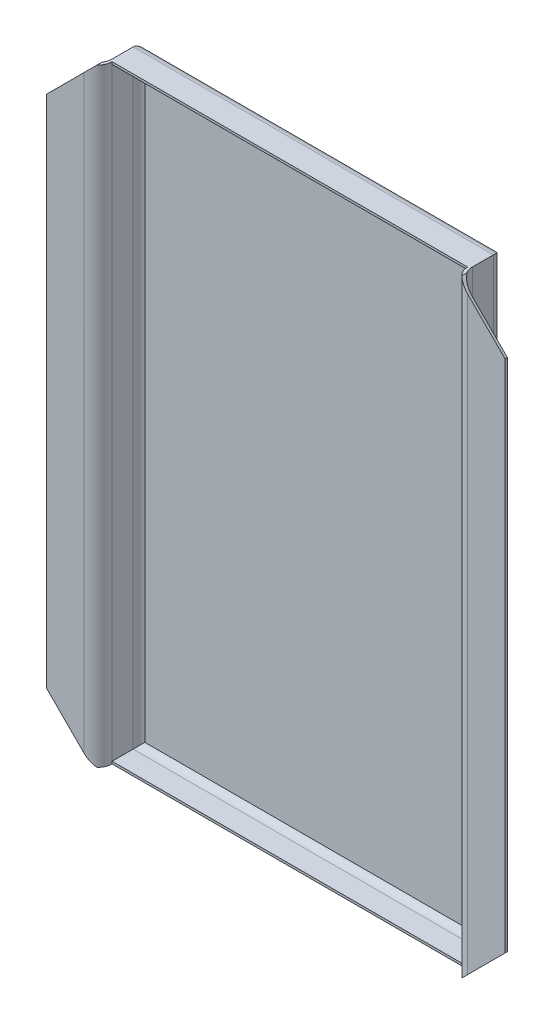
from build123d import *
from build123d.topology import SkipClean

# Parameters (mm, degrees)
SKETCH1_W                = 77
SKETCH1_H                = 130
BOSS_EXTRUDE1_DEPTH      = 10
SKETCH2_W                = 0.5
SKETCH2_H                = 130
BOSS_EXTRUDE2_DEPTH      = 10.5
CHAMFER1_SIZE            = 10
CHAMFER1_OF_MIRROR1_SIZE = 10
SHELL1_START             = -38
SHELL1_OUTLINE_W         = 129
SHELL1_OUTLINE_H         = 9.5
SHELL1_DEPTH             = 76
FILLET1_R                = 2
FILLET2_R                = 3
CUT_EXTRUDE1_DEPTH       = 135.25
SKETCH4_W                = 73
SKETCH4_H                = 126
BOSS_EXTRUDE3_DEPTH      = 1


# Read off the part's stored shape, not the designer's step: Shell1
with BuildPart() as part:
    # Sketch1 → Boss-Extrude1 (new body)
    with BuildSketch(Plane.XY):
        Rectangle(SKETCH1_W, SKETCH1_H)
    extrude(amount=BOSS_EXTRUDE1_DEPTH)

    # Sketch2 → Boss-Extrude2 (add)
    with BuildSketch(Plane(origin=(38.5, 0, 0), x_dir=(0, 0, -1), z_dir=(1, 0, 0))):
        with Locations((-9.75, 0)):
            Rectangle(SKETCH2_W, SKETCH2_H)
    boss_extrude2 = extrude(amount=BOSS_EXTRUDE2_DEPTH)

    # Chamfer1
    chamfer1_edges = [part.edges().sort_by_distance(p)[0] for p in [
        (49, -65, 9.75),
        (49, 65, 9.75),
    ]]
    chamfer(chamfer1_edges, length=CHAMFER1_SIZE)

    # Mirror1: Boss-Extrude2 across plane
    add(boss_extrude2.mirror(Plane(origin=(0, 0, 0), x_dir=(0, 0, 1), z_dir=(1, 0, 0))))

    # Chamfer1 of Mirror1
    chamfer1_of_mirror1_edges = [part.edges().sort_by_distance(p)[0] for p in [
        (-49, -65, 9.75),
        (-49, 65, 9.75),
    ]]
    chamfer(chamfer1_of_mirror1_edges, length=CHAMFER1_OF_MIRROR1_SIZE)

    # Shell1 outline → Shell1 (cut)
    with BuildSketch(Plane.YZ.offset(SHELL1_START)):
        with Locations((0, 5.25)):
            Rectangle(SHELL1_OUTLINE_W, SHELL1_OUTLINE_H)
    extrude(amount=SHELL1_DEPTH, mode=Mode.SUBTRACT)

    # Fillet1
    fillet1_edges = [part.edges().sort_by_distance(p)[0] for p in [
        (0, -65, 0),
        (-38.5, 0, 0),
        (0, 65, 0),
        (38.5, 0, 0),
        (38, 0, 0.5),
        (0, 64.5, 0.5),
        (-38, 0, 0.5),
        (0, -64.5, 0.5),
    ]]
    fillet(fillet1_edges, radius=FILLET1_R)

    # Fillet2
    # the kernel refuses this fillet: 3 mm, written as the material it adds along each edge
    with BuildSketch(Plane(origin=(-38.5, 65, 9.5), x_dir=(0, 0, -1), z_dir=(0, -1, 0))) as fillet2_piece_1_section:
        with BuildLine():
            CenterArc((FILLET2_R, -FILLET2_R), FILLET2_R, 90, 90)
            Line((0, -FILLET2_R), (0, 0))
            Line((0, 0), (FILLET2_R, 0))
        make_face()
    fillet2_piece_1 = extrude(amount=130, mode=Mode.PRIVATE)
    fillet2_piece_1 = split(fillet2_piece_1, bisect_by=Plane(origin=(-71.583154454, 32.416845546, 8.827874623), z_dir=(0.7071067811865476, -0.7071067811865476, 0)), keep=Keep.TOP, mode=Mode.PRIVATE)
    fillet2_piece_1 = split(fillet2_piece_1, bisect_by=Plane(origin=(-71.583154454, -32.416845546, 8.827874623), z_dir=(0.7071067811865476, 0.7071067811865476, 0)), keep=Keep.TOP, mode=Mode.PRIVATE)
    add(fillet2_piece_1)
    with BuildSketch(Plane(origin=(38.5, 65, 9.5), x_dir=(0, 0, -1), z_dir=(0, -1, 0))) as fillet2_piece_2_section:
        with BuildLine():
            CenterArc((FILLET2_R, FILLET2_R), FILLET2_R, 180, 90)
            Line((0, FILLET2_R), (0, 0))
            Line((0, 0), (FILLET2_R, 0))
        make_face()
    fillet2_piece_2 = extrude(amount=130, mode=Mode.PRIVATE)
    fillet2_piece_2 = split(fillet2_piece_2, bisect_by=Plane(origin=(71.583154454, 32.416845546, 8.827874623), z_dir=(-0.7071067811865476, -0.7071067811865476, 0)), keep=Keep.TOP, mode=Mode.PRIVATE)
    fillet2_piece_2 = split(fillet2_piece_2, bisect_by=Plane(origin=(71.583154454, -32.416845546, 8.827874623), z_dir=(-0.7071067811865476, 0.7071067811865476, 0)), keep=Keep.TOP, mode=Mode.PRIVATE)
    add(fillet2_piece_2)
    # the kernel refuses this fillet: 3 mm, written as the material it takes off along each edge
    with BuildSketch(Plane(origin=(38, 64.5, 10), x_dir=(1, 0, 0), z_dir=(0, -1, 0))) as fillet2_2_piece_1:
        with BuildLine():
            CenterArc((FILLET2_R, -FILLET2_R), FILLET2_R, 90, 90)
            Line((0, -FILLET2_R), (0, 0))
            Line((0, 0), (FILLET2_R, 0))
        make_face()
    extrude(amount=129, mode=Mode.SUBTRACT)
    with BuildSketch(Plane(origin=(-38, 64.5, 10), x_dir=(-1, 0, 0), z_dir=(0, -1, 0))) as fillet2_2_piece_2:
        with BuildLine():
            CenterArc((FILLET2_R, FILLET2_R), FILLET2_R, 180, 90)
            Line((0, FILLET2_R), (0, 0))
            Line((0, 0), (FILLET2_R, 0))
        make_face()
    extrude(amount=129, mode=Mode.SUBTRACT)

    # Sketch3 → Cut-Extrude1 (cut, symmetric)
    with SkipClean():  # the faces are left unmerged after this step: merging them gives an invalid solid
        with BuildSketch(Plane(origin=(0, -64.5, 0), x_dir=(1, 0, 0), z_dir=(0, 1, 0))):
            with BuildLine():
                Line((-38, -7), (38, -7))
                ThreePointArc((38, -7), (38.401923789, -8.5), (39.5, -9.598076211))
                Line((39.5, -9.598076211), (39.5, -10))
                Line((39.5, -10), (-39.5, -10))
                Line((-39.5, -10), (-39.5, -9.598076211))
                ThreePointArc((-39.5, -9.598076211), (-38.401923789, -8.5), (-38, -7))
            make_face()
        extrude(amount=CUT_EXTRUDE1_DEPTH, both=True, mode=Mode.SUBTRACT)


with BuildPart() as body_2:
    # Sketch4 → Boss-Extrude3 (new body)
    with BuildSketch(Plane.XY.offset(0.5)):
        Rectangle(SKETCH4_W, SKETCH4_H)
    extrude(amount=BOSS_EXTRUDE3_DEPTH)


solid = Compound([part.part, body_2.part])
